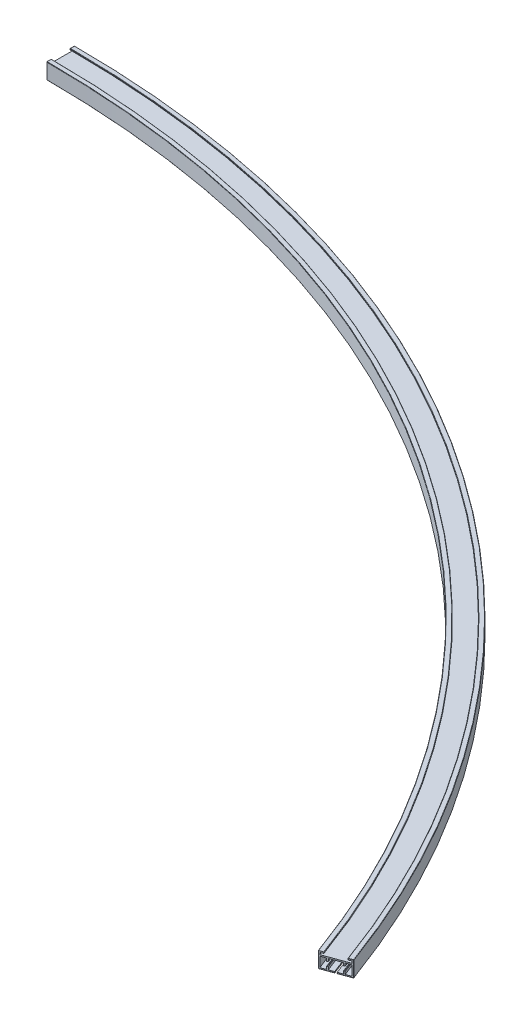
from build123d import *

# Parameters (mm, degrees)
REVOLVE_1_ANGLE = 70
FILLET_1_R      = 0.5
FILLET_2_R      = 0.5


with BuildPart() as part:
    # 草图1 → 旋转1 (revolve)
    with BuildSketch(Plane(origin=(0, 0, 0), x_dir=(0, 0, -1), z_dir=(1, 0, 0))):
        Polygon((-21, 6), (-14, 6), (-14, 4), (-19, 4), (-19, 1), (-0.046652987, 1), (0.046652987, 1), (19, 1), (19, 4), (14, 4), (14, 6), (21, 6), (21, -18), (1.520680953, -18), (1.520680953, -16), (9, -16), (9, -11.5), (11, -11.5), (11, -16), (19, -16), (19, -1), (11, -1), (11, -5.5), (9, -5.5), (9, -1), (-9, -1), (-9, -5.5), (-11, -5.5), (-11, -1), (-19, -1), (-19, -16), (-11, -16), (-11, -11.5), (-9, -11.5), (-9, -16), (-1.520680953, -16), (-1.520680953, -18), (-21, -18), align=None)
    revolve(axis=Axis((0, 82.1191999, 1480), (0, -1, 0)), revolution_arc=REVOLVE_1_ANGLE)

    # 圆角1
    fillet_1_edges = [part.edges().sort_by_distance(p)[0] for p in [
        (0, 6, -17.5),
        (860.938230963, 6, 250.452781522),
        (1407.189699627, 6, 967.82483537),
        (856.923195908, 6, 256.186845832),
        (0, -6, 21),
        (836.848020636, 6, 284.857167382),
        (1371.011533727, -6, 980.992610888),
        (836.848020636, -18, 284.857167382),
        (856.923195908, 4, 256.186845832),
        (860.938230963, -18, 250.452781522),
        (1410.4786238, -6, 966.627764868),
        (1401.326337616, -18, 969.958924614),
        (1380.16381991, -18, 977.661451142),
        (840.863055691, 4, 279.123103072),
        (840.863055691, 6, 279.123103072),
    ]]
    fillet(fillet_1_edges, radius=FILLET_1_R)

    # 圆角2
    # the kernel refuses this fillet: 0.5 mm, written as the material it takes off along each edge
    with BuildSketch(Plane(origin=(1379.233844159, -11.5, 977.999934634), x_dir=(0, -1, 0), z_dir=(0.9396926207859094, 0, -0.34202014332566616)), Plane(origin=(1383.462460952, -5.5, 976.460843989), x_dir=(0, 1, 0), z_dir=(-0.9396926207859094, 0, 0.34202014332566616)), Plane(origin=(1402.256313368, -5.5, 969.620441122), x_dir=(0, 1, 0), z_dir=(-0.9396926207859094, 0, 0.34202014332566616)), Plane(origin=(1398.027696574, -11.5, 971.159531767), x_dir=(0, -1, 0), z_dir=(0.9396926207859094, 0, -0.34202014332566616))) as fillet_2_piece_1:
        with BuildLine():
            CenterArc((FILLET_2_R, FILLET_2_R), FILLET_2_R, 180, 90)
            Line((0, FILLET_2_R), (0, 0))
            Line((0, 0), (FILLET_2_R, 0))
        make_face()
    extrude(amount=4.5, mode=Mode.SUBTRACT)
    with BuildSketch(Plane(origin=(0, -11.5, 12.25), x_dir=(0, -1, 0), z_dir=(0, 0, -1)), Plane(origin=(0, -5.5, 7.75), x_dir=(0, 1, 0), z_dir=(0, 0, 1)), Plane(origin=(0, -5.5, -12.25), x_dir=(0, 1, 0), z_dir=(0, 0, 1)), Plane(origin=(0, -11.5, -7.75), x_dir=(0, -1, 0), z_dir=(0, 0, -1))) as fillet_2_piece_2:
        with BuildLine():
            CenterArc((FILLET_2_R, -FILLET_2_R), FILLET_2_R, 90, 90)
            Line((0, -FILLET_2_R), (0, 0))
            Line((0, 0), (FILLET_2_R, 0))
        make_face()
    extrude(amount=4.5, mode=Mode.SUBTRACT)
    with BuildSketch(Plane(origin=(0, -11.5, 1480), x_dir=(-0.0008396934722152373, 0, -0.9999996474573741), z_dir=(-0.9999996474573741, 0, 0.0008396934722152373))) as fillet_2_piece_3:
        with BuildLine():
            CenterArc((1489 + FILLET_2_R, FILLET_2_R), FILLET_2_R, 180, 90)
            Line((1489 + FILLET_2_R, 0), (1489, 0))
            Line((1489, 0), (1489, FILLET_2_R))
        make_face()
    revolve(axis=Axis((0, -11.5, 1480), (0, -1, 0)), revolution_arc=70.096221795, mode=Mode.SUBTRACT)
    with BuildSketch(Plane(origin=(0, -11.5, 1480), x_dir=(-0.0008385671230867866, 0, -0.9999996484025282), z_dir=(-0.9999996484025282, 0, 0.0008385671230867866))) as fillet_2_piece_4:
        with BuildLine():
            CenterArc((1491 - FILLET_2_R, FILLET_2_R), FILLET_2_R, 270, 90)
            Line((1491, FILLET_2_R), (1491, 0))
            Line((1491, 0), (1491 - FILLET_2_R, 0))
        make_face()
    revolve(axis=Axis((0, -11.5, 1480), (0, -1, 0)), revolution_arc=70.096092725, mode=Mode.SUBTRACT)
    with BuildSketch(Plane(origin=(0, -5.5, 1480), x_dir=(-0.0008385671230867866, 0, -0.9999996484025282), z_dir=(-0.9999996484025282, 0, 0.0008385671230867866))) as fillet_2_piece_5:
        with BuildLine():
            CenterArc((1491 - FILLET_2_R, -FILLET_2_R), FILLET_2_R, 0, 90)
            Line((1491, -FILLET_2_R), (1491, 0))
            Line((1491, 0), (1491 - FILLET_2_R, 0))
        make_face()
    revolve(axis=Axis((0, -5.5, 1480), (0, -1, 0)), revolution_arc=70.096092725, mode=Mode.SUBTRACT)
    with BuildSketch(Plane(origin=(0, -5.5, 1480), x_dir=(-0.0008396934722152373, 0, -0.9999996474573741), z_dir=(-0.9999996474573741, 0, 0.0008396934722152373))) as fillet_2_piece_6:
        with BuildLine():
            CenterArc((1489 + FILLET_2_R, -FILLET_2_R), FILLET_2_R, 90, 90)
            Line((1489 + FILLET_2_R, 0), (1489, 0))
            Line((1489, 0), (1489, -FILLET_2_R))
        make_face()
    revolve(axis=Axis((0, -5.5, 1480), (0, -1, 0)), revolution_arc=70.096221795, mode=Mode.SUBTRACT)
    with BuildSketch(Plane(origin=(0, -5.5, 1480), x_dir=(-0.0008499684408638254, 0, -0.9999996387767596), z_dir=(-0.9999996387767596, 0, 0.0008499684408638254))) as fillet_2_piece_7:
        with BuildLine():
            CenterArc((1471 - FILLET_2_R, -FILLET_2_R), FILLET_2_R, 0, 90)
            Line((1471, -FILLET_2_R), (1471, 0))
            Line((1471, 0), (1471 - FILLET_2_R, 0))
        make_face()
    revolve(axis=Axis((0, -5.5, 1480), (0, -1, 0)), revolution_arc=70.09739922, mode=Mode.SUBTRACT)
    with BuildSketch(Plane(origin=(0, -5.5, 1480), x_dir=(-0.0008511256474475692, 0, -0.9999996377925005), z_dir=(-0.9999996377925005, 0, 0.0008511256474475692))) as fillet_2_piece_8:
        with BuildLine():
            CenterArc((1469 + FILLET_2_R, -FILLET_2_R), FILLET_2_R, 90, 90)
            Line((1469 + FILLET_2_R, 0), (1469, 0))
            Line((1469, 0), (1469, -FILLET_2_R))
        make_face()
    revolve(axis=Axis((0, -5.5, 1480), (0, -1, 0)), revolution_arc=70.097531827, mode=Mode.SUBTRACT)
    with BuildSketch(Plane(origin=(0, -11.5, 1480), x_dir=(-0.0008511256474475692, 0, -0.9999996377925005), z_dir=(-0.9999996377925005, 0, 0.0008511256474475692))) as fillet_2_piece_9:
        with BuildLine():
            CenterArc((1469 + FILLET_2_R, FILLET_2_R), FILLET_2_R, 180, 90)
            Line((1469, FILLET_2_R), (1469, 0))
            Line((1469, 0), (1469 + FILLET_2_R, 0))
        make_face()
    revolve(axis=Axis((0, -11.5, 1480), (0, -1, 0)), revolution_arc=70.097531827, mode=Mode.SUBTRACT)
    with BuildSketch(Plane(origin=(0, -11.5, 1480), x_dir=(-0.0008499684408638254, 0, -0.9999996387767596), z_dir=(-0.9999996387767596, 0, 0.0008499684408638254))) as fillet_2_piece_10:
        with BuildLine():
            CenterArc((1471 - FILLET_2_R, FILLET_2_R), FILLET_2_R, 270, 90)
            Line((1471 - FILLET_2_R, 0), (1471, 0))
            Line((1471, 0), (1471, FILLET_2_R))
        make_face()
    revolve(axis=Axis((0, -11.5, 1480), (0, -1, 0)), revolution_arc=70.09739922, mode=Mode.SUBTRACT)


solid = part.part
